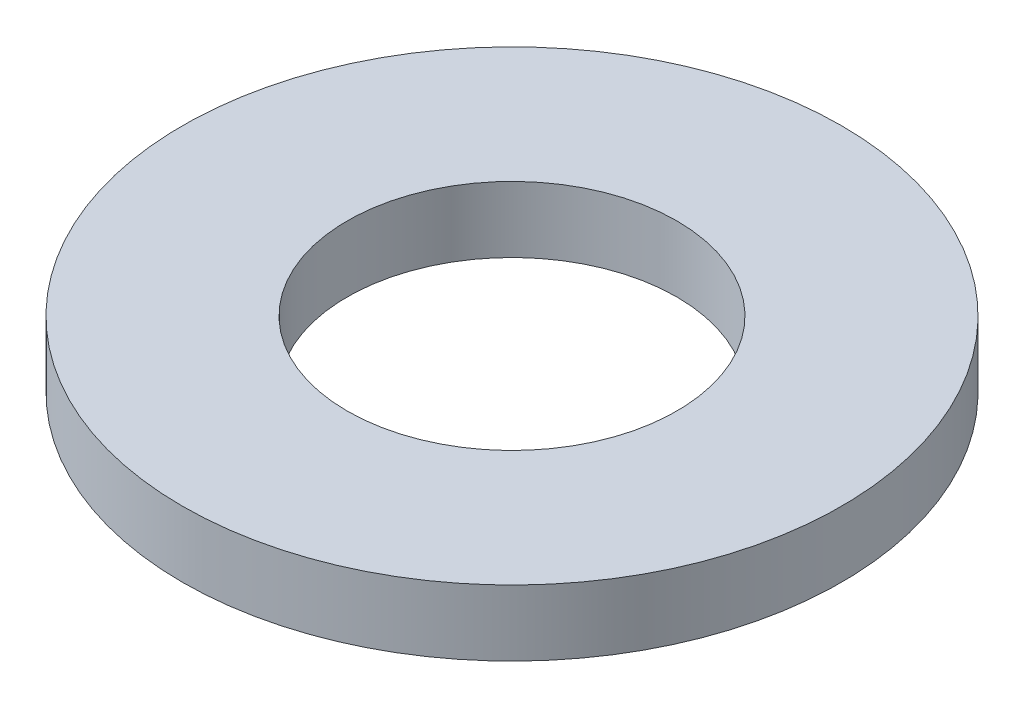
from build123d import *

# Parameters (mm, degrees)
SKETCH1_R           = 35
BOSS_EXTRUDE1_DEPTH = 7
SKETCH2_R           = 17.5
CUT_EXTRUDE1_DEPTH  = 50.989999


with BuildPart() as part:
    # Sketch1 → Boss-Extrude1 (new body)
    with BuildSketch(Plane(origin=(0, 0, 0), x_dir=(1, 0, 0), z_dir=(0, 1, 0))):
        Circle(SKETCH1_R)
    extrude(amount=BOSS_EXTRUDE1_DEPTH)

    # Sketch2 → Cut-Extrude1 (cut, through all)
    with BuildSketch(Plane(origin=(0, 0, 0), x_dir=(1, 0, 0), z_dir=(0, 1, 0))):
        Circle(SKETCH2_R)
    extrude(amount=CUT_EXTRUDE1_DEPTH, mode=Mode.SUBTRACT)


solid = part.part
